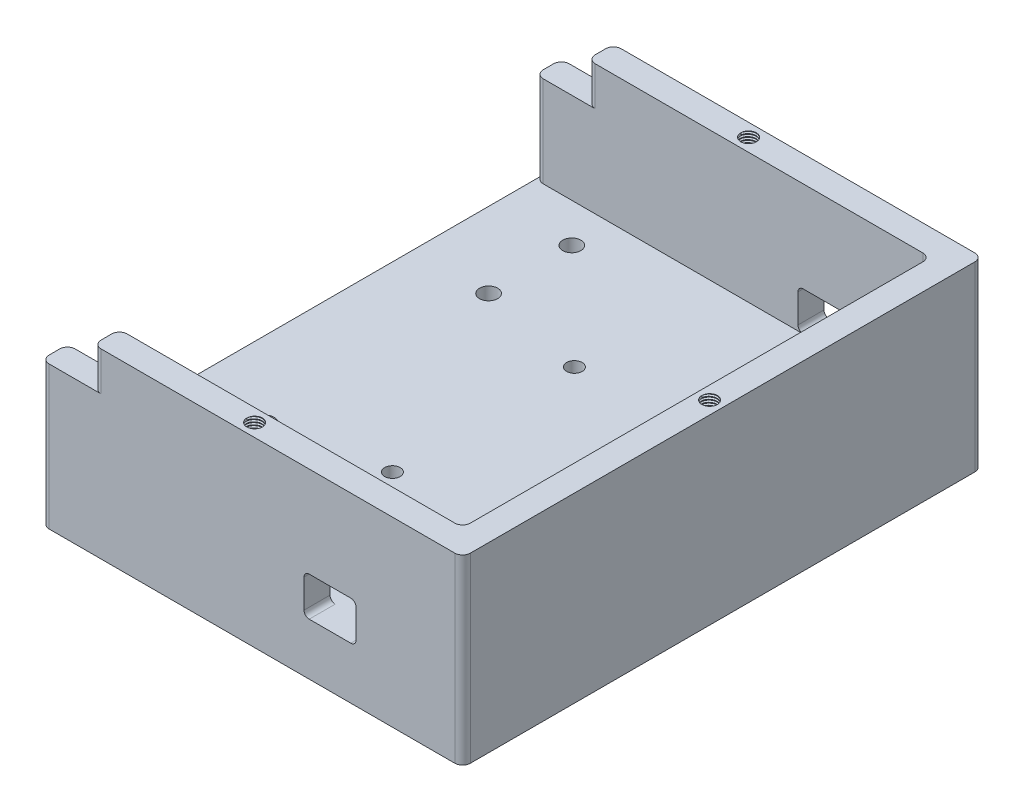
from build123d import *
from build123d.topology import SkipClean

# Parameters (mm, degrees)
SKETCH1_W            = 297
SKETCH1_H            = 200
BOSS_EXTRUDE1_DEPTH  = 10
SKETCH10_W           = 40
SKETCH10_H           = 50
CUT_EXTRUDE1_DEPTH   = 5
SKETCH10_3_W         = 40
SKETCH10_3_H         = 50
BOSS_EXTRUDE2_DEPTH  = 5
SKETCH12_R           = 3
CUT_EXTRUDE2_DEPTH   = 5
SKETCH12_3_R         = 3
CUT_EXTRUDE3_DEPTH   = 5
BOSS_EXTRUDE3_DEPTH  = 50
BOSS_EXTRUDE4_DEPTH  = 10
FILLET1_R            = 3
CUT_EXTRUDE4_REACH   = 363.537
SKETCH15_R           = 3
SKETCH17_W           = 155
SKETCH17_H           = 10
CUT_EXTRUDE6_DEPTH   = 15
CUT_EXTRUDE7_REACH   = 363.537
SKETCH18_R           = 3.5
FILLET2_R            = 3
CUT_EXTRUDE8_REACH   = 358.103
SKETCH20_W           = 20
SKETCH20_H           = 15
FILLET3_R            = 2
FILLET3_OF_MIRROR3_R = 2
CUT_EXTRUDE9_REACH   = 364.262
SKETCH21_W           = 175
SKETCH21_H           = 200
FILLET4_R            = 3
THREAD1_PITCH        = 1
THREAD2_PITCH        = 1
THREAD3_PITCH        = 1


# Read off the part's stored shape, not the designer's step: AdvancedHole1
with BuildPart() as part:
    # Sketch1 → Boss-Extrude1 (new body)
    with BuildSketch(Plane(origin=(0, 0, 0), x_dir=(1, 0, 0), z_dir=(0, 1, 0))):
        with Locations((148.5, 100)):
            Rectangle(SKETCH1_W, SKETCH1_H)
    extrude(amount=-BOSS_EXTRUDE1_DEPTH)

    # Sketch10 → Cut-Extrude1 (cut)
    with BuildSketch(Plane(origin=(0, 0, 0), x_dir=(1, 0, 0), z_dir=(0, 1, 0))):
        with Locations((20, 150)):
            Rectangle(SKETCH10_W, SKETCH10_H)
    extrude(amount=-CUT_EXTRUDE1_DEPTH, mode=Mode.SUBTRACT)

    # Sketch10<3> → Boss-Extrude2 (add)
    with BuildSketch(Plane(origin=(0, 0, 0), x_dir=(1, 0, 0), z_dir=(0, 1, 0))):
        with Locations((-20, 50)):
            Rectangle(SKETCH10_3_W, SKETCH10_3_H)
    extrude(amount=-BOSS_EXTRUDE2_DEPTH)

    # Sketch12 → Cut-Extrude2 (cut)
    with BuildSketch(Plane(origin=(0, -5, 0), x_dir=(1, 0, 0), z_dir=(0, 1, 0))):
        with Locations(Location((25, 150, 0), (0, 0, 270))):
            Circle(SKETCH12_R)
    extrude(amount=-CUT_EXTRUDE2_DEPTH, mode=Mode.SUBTRACT)

    # Sketch12<3> → Cut-Extrude3 (cut)
    with BuildSketch(Plane(origin=(0, -5, 0), x_dir=(1, 0, 0), z_dir=(0, 1, 0))):
        with Locations(Location((-25, 50, 0), (0, 0, 270))):
            Circle(SKETCH12_3_R)
    extrude(amount=CUT_EXTRUDE3_DEPTH, mode=Mode.SUBTRACT)

    # Sketch13 → Boss-Extrude3 (add)
    with BuildSketch(Plane(origin=(0, 0, 0), x_dir=(1, 0, 0), z_dir=(0, 1, 0))):
        Polygon((0, 190), (287, 190), (287, 10), (0, 10), (0, 0), (297, 0), (297, 200), (0, 200), align=None)
    extrude(amount=BOSS_EXTRUDE3_DEPTH)

    # Sketch14 → Boss-Extrude4 (add)
    with BuildSketch(Plane.XZ.offset(10)):
        Polygon((230, -190), (287, -190), (287, -160), (287, -10), (0, -10), (0, 0), (297, 0), (297, -160), (297, -200), (230, -200), (0, -200), (0, -190), align=None)
    boss_extrude4 = extrude(amount=BOSS_EXTRUDE4_DEPTH)

    # Mirror1: Boss-Extrude4 across plane
    add(boss_extrude4.mirror(Plane(origin=(0, 0, -100), x_dir=(1, 0, 0), z_dir=(0, 0, -1))))

    # Fillet1
    fillet1_edges = [part.edges().sort_by_distance(p)[0] for p in [
        (40, -2.5, -125),
        (0, -2.5, -125),
        (0, -2.5, -175),
        (40, -2.5, -175),
        (-40, -2.5, -25),
        (-40, -2.5, -75),
        (0, -2.5, -75),
        (0, -2.5, -25),
        (0, 25, -190),
        (287, 25, -190),
        (287, 25, -10),
        (0, 25, -10),
        (0, 15, -200),
        (287, -15, -190),
        (0, 15, 0),
        (297, 15, 0),
        (297, 15, -200),
    ]]
    fillet(fillet1_edges, radius=FILLET1_R)

    # Sketch15 → Cut-Extrude4 (cut, up to next)
    with BuildSketch(Plane(origin=(0, 0, 0), x_dir=(1, 0, 0), z_dir=(0, 1, 0)), mode=Mode.PRIVATE) as cut_extrude4_sk1:
        with Locations(Location((205, 65, 0), (0, 0, 270))):
            Circle(SKETCH15_R)
    cut_extrude4_tool1 = extrude(cut_extrude4_sk1.sketch, amount=-CUT_EXTRUDE4_REACH, mode=Mode.PRIVATE) & part.part
    # Sketch15 → Cut-Extrude4 (cut, up to next)
    with BuildSketch(Plane(origin=(0, 0, 0), x_dir=(1, 0, 0), z_dir=(0, 1, 0)), mode=Mode.PRIVATE) as cut_extrude4_sk2:
        with Locations(Location((205, 135, 0), (0, 0, 270))):
            Circle(SKETCH15_R)
    cut_extrude4_tool2 = extrude(cut_extrude4_sk2.sketch, amount=-CUT_EXTRUDE4_REACH, mode=Mode.PRIVATE) & part.part
    add(cut_extrude4_tool1.solids().sort_by_distance((205, 0, -65))[0], mode=Mode.SUBTRACT)
    add(cut_extrude4_tool2.solids().sort_by_distance((205, 0, -135))[0], mode=Mode.SUBTRACT)

    # Sketch17 → Cut-Extrude6 (cut)
    with BuildSketch(Plane(origin=(0, 50, 0), x_dir=(1, 0, 0), z_dir=(0, 1, 0))):
        with Locations((77.5, 5)):
            Rectangle(SKETCH17_W, SKETCH17_H)
        with Locations((77.5, 195)):
            Rectangle(SKETCH17_W, SKETCH17_H)
    extrude(amount=-CUT_EXTRUDE6_DEPTH, mode=Mode.SUBTRACT)

    # Sketch18 → Cut-Extrude7 (cut, up to next)
    with BuildSketch(Plane(origin=(0, 0, 0), x_dir=(1, 0, 0), z_dir=(0, 1, 0)), mode=Mode.PRIVATE) as cut_extrude7_sk1:
        with Locations(Location((164, 175, 0), (0, 0, 270))):
            Circle(SKETCH18_R)
    cut_extrude7_tool1 = extrude(cut_extrude7_sk1.sketch, amount=-CUT_EXTRUDE7_REACH, mode=Mode.PRIVATE) & part.part
    # Sketch18 → Cut-Extrude7 (cut, up to next)
    with BuildSketch(Plane(origin=(0, 0, 0), x_dir=(1, 0, 0), z_dir=(0, 1, 0)), mode=Mode.PRIVATE) as cut_extrude7_sk2:
        with Locations(Location((164, 143, 0), (0, 0, 270))):
            Circle(SKETCH18_R)
    cut_extrude7_tool2 = extrude(cut_extrude7_sk2.sketch, amount=-CUT_EXTRUDE7_REACH, mode=Mode.PRIVATE) & part.part
    cut_extrude7_1 = cut_extrude7_tool1.solids().sort_by_distance((164, 0, -175))[0]
    add(cut_extrude7_1, mode=Mode.SUBTRACT)
    cut_extrude7_2 = cut_extrude7_tool2.solids().sort_by_distance((164, 0, -143))[0]
    add(cut_extrude7_2, mode=Mode.SUBTRACT)
    cut_extrude7 = cut_extrude7_1 + cut_extrude7_2  # Cut-Extrude7 as one shape, for the pattern or mirror that repeats it

    # Mirror2: Cut-Extrude7 across plane
    add(cut_extrude7.mirror(Plane(origin=(0, 0, -100), x_dir=(1, 0, 0), z_dir=(0, 0, -1))), mode=Mode.SUBTRACT)

    # Fillet2
    fillet2_edges = [part.edges().sort_by_distance(p)[0] for p in [
        (155, 42.5, -10),
        (155, 42.5, 0),
        (155, 42.5, -190),
        (155, 42.5, -200),
        (0, -15, -10),
        (287, -15, -10),
        (0, -15, -190),
    ]]
    fillet(fillet2_edges, radius=FILLET2_R)

    # Sketch20 → Cut-Extrude8 (cut, up to next)
    with BuildSketch(Plane(origin=(0, 0, -10), x_dir=(-1, 0, 0), z_dir=(0, 0, -1)), mode=Mode.PRIVATE) as cut_extrude8_sk1:
        with Locations((-246, 7.5)):
            Rectangle(SKETCH20_W, SKETCH20_H)
    cut_extrude8_tool1 = extrude(cut_extrude8_sk1.sketch, amount=-CUT_EXTRUDE8_REACH, mode=Mode.PRIVATE) & part.part
    cut_extrude8 = cut_extrude8_tool1.solids().sort_by_distance((246, 7.5, -10))[0]
    add(cut_extrude8, mode=Mode.SUBTRACT)

    # Fillet3
    fillet3_edges = [part.edges().sort_by_distance(p)[0] for p in [
        (256, 0, -5),
        (256, 15, -5),
        (236, 15, -5),
        (236, 0, -5),
    ]]
    fillet(fillet3_edges, radius=FILLET3_R)

    # Mirror3: Cut-Extrude8 across plane
    add(cut_extrude8.mirror(Plane.XY.offset(-100)), mode=Mode.SUBTRACT)

    # Fillet3 of Mirror3
    fillet3_of_mirror3_edges = [part.edges().sort_by_distance(p)[0] for p in [
        (256, 0, -195),
        (256, 15, -195),
        (236, 15, -195),
        (236, 0, -195),
    ]]
    fillet(fillet3_of_mirror3_edges, radius=FILLET3_OF_MIRROR3_R)

    # Sketch21 → Cut-Extrude9 (cut, up to next)
    with BuildSketch(Plane(origin=(0, 35, 0), x_dir=(1, 0, 0), z_dir=(0, 1, 0)), mode=Mode.PRIVATE) as cut_extrude9_sk1:
        with Locations((47.5, 100)):
            Rectangle(SKETCH21_W, SKETCH21_H)
    cut_extrude9_tool1 = extrude(cut_extrude9_sk1.sketch, amount=-CUT_EXTRUDE9_REACH, mode=Mode.PRIVATE) & part.part
    add(cut_extrude9_tool1.solids().sort_by_distance((47.5, 35, -100))[0], mode=Mode.SUBTRACT)

    # Fillet4
    fillet4_edges = [part.edges().sort_by_distance(p)[0] for p in [
        (135, 17.5, -190),
        (135, 17.5, -10),
        (135, -15, -10),
        (135, -15, -190),
        (135, 7.5, 0),
        (135, 7.5, -200),
    ]]
    fillet(fillet4_edges, radius=FILLET4_R)

    # AdvancedHole1 outline → AdvancedHole1 (revolve, cut)
    with BuildSketch(Plane(origin=(292, 0, -100), x_dir=(1, 0, 0), z_dir=(0, 0, 1))):
        Polygon((0, 38.197418143), (3, 40), (3, 50), (0, 50), align=None)
    revolve(axis=Axis((292, 0, -100), (0, 1, 0)), mode=Mode.SUBTRACT)

    # AdvancedHole1 2 outline → AdvancedHole1 2 (revolve, cut)
    with BuildSketch(Plane(origin=(212, 0, -195), x_dir=(1, 0, 0), z_dir=(0, 0, 1))):
        Polygon((0, 38.197418143), (3, 40), (3, 50), (0, 50), align=None)
    revolve(axis=Axis((212, 0, -195), (0, 1, 0)), mode=Mode.SUBTRACT)

    # AdvancedHole1 3 outline → AdvancedHole1 3 (revolve, cut)
    with BuildSketch(Plane(origin=(212, 0, -5), x_dir=(1, 0, 0), z_dir=(0, 0, 1))):
        Polygon((0, 38.197418143), (3, 40), (3, 50), (0, 50), align=None)
    revolve(axis=Axis((212, 0, -5), (0, 1, 0)), mode=Mode.SUBTRACT)

    # Thread1: the profile of Thread Profile1 profile screwed along a right-hand helix of 10 turns, 8 arcs to a turn; built about Z, then put on its axis
    with SkipClean():  # the faces are left unmerged after this step: merging them gives an invalid solid
        thread1_z = Axis((0, 0, 0), (0, 0, 1))
        thread1_corners = [(2.9997, 0, -0.000173205), (3.541265875, 0, 0.312499999), (3.541265875, 0, 0.437499999), (2.9997, 0, 0.750173202)]
        with BuildLine(mode=Mode.PRIVATE) as thread1_profile:
            Line(thread1_corners[0], thread1_corners[1])
            Line(thread1_corners[1], thread1_corners[2])
            Line(thread1_corners[2], thread1_corners[3])
            Line(thread1_corners[3], thread1_corners[0])
        thread1_cap = Face(thread1_profile.wire())
        thread1_turn_angles = [0, 22.5, 45, 67.5, 90, 112.5, 135, 157.5, 180, 202.5, 225, 247.5, 270, 292.5, 315, 337.5, 360]
        thread1_turn_weights = [1, 0.9238795325112867, 1, 0.9238795325112867, 1, 0.9238795325112867, 1, 0.9238795325112867, 1, 0.9238795325112867, 1, 0.9238795325112867, 1, 0.9238795325112867, 1, 0.9238795325112867, 1]
        thread1_turn_rails = [Edge.make_bspline([Vector(p[0], p[1], 0).rotate(thread1_z, thread1_turn_angles[k]) / thread1_turn_weights[k] + Vector(0, 0, p[2] + THREAD1_PITCH * thread1_turn_angles[k] / 360) for k in range(17)], [0, 0, 0, 1, 1, 2, 2, 3, 3, 4, 4, 5, 5, 6, 6, 7, 7, 8, 8, 8], 2, thread1_turn_weights) for p in thread1_corners]
        thread1_turn_sides = [Face.make_surface_from_curves(thread1_turn_rails[p[0]], thread1_turn_rails[p[1]]) for p in [(0, 1), (1, 2), (2, 3), (3, 0)]]
        thread1 = Plane(origin=(212, 50, -195), x_dir=(-1, 0, 0), z_dir=(0, -1, 0)) * Solid(Shell([*[p.moved(Location((0, 0, THREAD1_PITCH * i))) for i in range(10) for p in thread1_turn_sides], thread1_cap, thread1_cap.rotate(thread1_z, 3600).moved(Location((0, 0, THREAD1_PITCH * 3600 / 360)))]))
        add(thread1, mode=Mode.SUBTRACT)

    # Thread2: the profile of Thread Profile2 profile screwed along a right-hand helix of 10 turns, 8 arcs to a turn; built about Z, then put on its axis
    with SkipClean():  # the faces are left unmerged after this step: merging them gives an invalid solid
        thread2_z = Axis((0, 0, 0), (0, 0, 1))
        thread2_corners = [(2.9997, 0, -0.000173205), (3.541265875, 0, 0.312499999), (3.541265875, 0, 0.437499999), (2.9997, 0, 0.750173202)]
        with BuildLine(mode=Mode.PRIVATE) as thread2_profile:
            Line(thread2_corners[0], thread2_corners[1])
            Line(thread2_corners[1], thread2_corners[2])
            Line(thread2_corners[2], thread2_corners[3])
            Line(thread2_corners[3], thread2_corners[0])
        thread2_cap = Face(thread2_profile.wire())
        thread2_turn_angles = [0, 22.5, 45, 67.5, 90, 112.5, 135, 157.5, 180, 202.5, 225, 247.5, 270, 292.5, 315, 337.5, 360]
        thread2_turn_weights = [1, 0.9238795325112867, 1, 0.9238795325112867, 1, 0.9238795325112867, 1, 0.9238795325112867, 1, 0.9238795325112867, 1, 0.9238795325112867, 1, 0.9238795325112867, 1, 0.9238795325112867, 1]
        thread2_turn_rails = [Edge.make_bspline([Vector(p[0], p[1], 0).rotate(thread2_z, thread2_turn_angles[k]) / thread2_turn_weights[k] + Vector(0, 0, p[2] + THREAD2_PITCH * thread2_turn_angles[k] / 360) for k in range(17)], [0, 0, 0, 1, 1, 2, 2, 3, 3, 4, 4, 5, 5, 6, 6, 7, 7, 8, 8, 8], 2, thread2_turn_weights) for p in thread2_corners]
        thread2_turn_sides = [Face.make_surface_from_curves(thread2_turn_rails[p[0]], thread2_turn_rails[p[1]]) for p in [(0, 1), (1, 2), (2, 3), (3, 0)]]
        thread2 = Plane(origin=(212, 50, -5), x_dir=(-1, 0, 0), z_dir=(0, -1, 0)) * Solid(Shell([*[p.moved(Location((0, 0, THREAD2_PITCH * i))) for i in range(10) for p in thread2_turn_sides], thread2_cap, thread2_cap.rotate(thread2_z, 3600).moved(Location((0, 0, THREAD2_PITCH * 3600 / 360)))]))
        add(thread2, mode=Mode.SUBTRACT)

    # Thread3: the profile of Thread Profile3 profile screwed along a right-hand helix of 10 turns, 8 arcs to a turn; built about Z, then put on its axis
    with SkipClean():  # the faces are left unmerged after this step: merging them gives an invalid solid
        thread3_z = Axis((0, 0, 0), (0, 0, 1))
        thread3_corners = [(2.9997, 0, -0.000173205), (3.541265875, 0, 0.312499999), (3.541265875, 0, 0.437499999), (2.9997, 0, 0.750173202)]
        with BuildLine(mode=Mode.PRIVATE) as thread3_profile:
            Line(thread3_corners[0], thread3_corners[1])
            Line(thread3_corners[1], thread3_corners[2])
            Line(thread3_corners[2], thread3_corners[3])
            Line(thread3_corners[3], thread3_corners[0])
        thread3_cap = Face(thread3_profile.wire())
        thread3_turn_angles = [0, 22.5, 45, 67.5, 90, 112.5, 135, 157.5, 180, 202.5, 225, 247.5, 270, 292.5, 315, 337.5, 360]
        thread3_turn_weights = [1, 0.9238795325112867, 1, 0.9238795325112867, 1, 0.9238795325112867, 1, 0.9238795325112867, 1, 0.9238795325112867, 1, 0.9238795325112867, 1, 0.9238795325112867, 1, 0.9238795325112867, 1]
        thread3_turn_rails = [Edge.make_bspline([Vector(p[0], p[1], 0).rotate(thread3_z, thread3_turn_angles[k]) / thread3_turn_weights[k] + Vector(0, 0, p[2] + THREAD3_PITCH * thread3_turn_angles[k] / 360) for k in range(17)], [0, 0, 0, 1, 1, 2, 2, 3, 3, 4, 4, 5, 5, 6, 6, 7, 7, 8, 8, 8], 2, thread3_turn_weights) for p in thread3_corners]
        thread3_turn_sides = [Face.make_surface_from_curves(thread3_turn_rails[p[0]], thread3_turn_rails[p[1]]) for p in [(0, 1), (1, 2), (2, 3), (3, 0)]]
        thread3 = Plane(origin=(292, 50, -100), x_dir=(-1, 0, 0), z_dir=(0, -1, 0)) * Solid(Shell([*[p.moved(Location((0, 0, THREAD3_PITCH * i))) for i in range(10) for p in thread3_turn_sides], thread3_cap, thread3_cap.rotate(thread3_z, 3600).moved(Location((0, 0, THREAD3_PITCH * 3600 / 360)))]))
        add(thread3, mode=Mode.SUBTRACT)


solid = part.part
